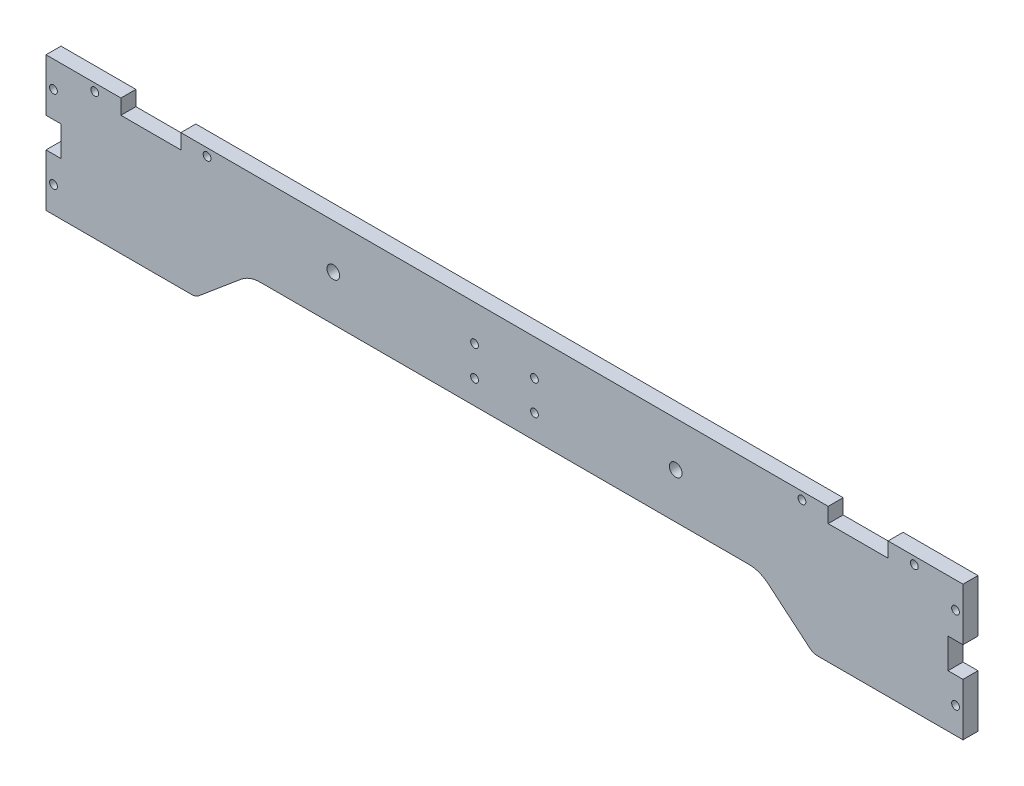
from build123d import *

# Parameters (mm, degrees)
SKETCH1_R           = 1.65
SKETCH1_R_2         = 2.7
BOSS_EXTRUDE1_DEPTH = 6.35


with BuildPart() as part:
    # Sketch1 → Boss-Extrude1 (new body)
    with BuildSketch(Plane.XY.offset(222.25)):
        with BuildLine():
            Line((-25.4, 57.15), (-25.4, 50.8))
            Line((-25.4, 50.8), (-50.8, 50.8))
            Line((-50.8, 50.8), (-50.8, 57.15))
            Line((-50.8, 57.15), (-325.12, 57.15))
            Line((-325.12, 57.15), (-325.12, 50.8))
            Line((-325.12, 50.8), (-350.52, 50.8))
            Line((-350.52, 50.8), (-350.52, 57.15))
            Line((-350.52, 57.15), (-382.27, 57.15))
            Line((-382.27, 57.15), (-382.27, 34.925))
            Line((-382.27, 34.925), (-375.92, 34.925))
            Line((-375.92, 34.925), (-375.92, 22.225))
            Line((-375.92, 22.225), (-382.27, 22.225))
            Line((-382.27, 22.225), (-382.27, 0))
            Line((-382.27, 0), (-320.61896879, 0))
            ThreePointArc((-320.61896879, 0), (-318.881506462, 0.306361486), (-317.353607733, 1.188494229))
            Line((-317.353607733, 1.188494229), (-299.608074729, 16.078764428))
            ThreePointArc((-299.608074729, 16.078764428), (-295.788327906, 18.284096284), (-291.444672086, 19.05))
            Line((-291.444672086, 19.05), (-84.475327914, 19.05))
            ThreePointArc((-84.475327914, 19.05), (-80.131672094, 18.284096284), (-76.311925271, 16.078764428))
            Line((-76.311925271, 16.078764428), (-58.566392267, 1.188494229))
            ThreePointArc((-58.566392267, 1.188494229), (-57.038493538, 0.306361486), (-55.30103121, 0))
            Line((-55.30103121, 0), (6.35, 0))
            Line((6.35, 0), (6.35, 22.225))
            Line((6.35, 22.225), (0, 22.225))
            Line((0, 22.225), (0, 34.925))
            Line((0, 34.925), (6.35, 34.925))
            Line((6.35, 34.925), (6.35, 57.15))
            Line((6.35, 57.15), (-25.4, 57.15))
        make_face()
        with Locations((-379.095, 11.1125)):
            Circle(SKETCH1_R, mode=Mode.SUBTRACT)
        with Locations((3.175, 11.1125)):
            Circle(SKETCH1_R, mode=Mode.SUBTRACT)
        with Locations((-379.095, 46.0375)):
            Circle(SKETCH1_R, mode=Mode.SUBTRACT)
        with Locations((3.175, 46.0375)):
            Circle(SKETCH1_R, mode=Mode.SUBTRACT)
        with Locations((-175.260005593, 41.91)):
            Circle(SKETCH1_R, mode=Mode.SUBTRACT)
        with Locations((-200.66, 41.91)):
            Circle(SKETCH1_R, mode=Mode.SUBTRACT)
        with Locations((-175.260005593, 29.21)):
            Circle(SKETCH1_R, mode=Mode.SUBTRACT)
        with Locations((-200.66, 29.21)):
            Circle(SKETCH1_R, mode=Mode.SUBTRACT)
        with Locations((-14.2875, 53.975)):
            Circle(SKETCH1_R, mode=Mode.SUBTRACT)
        with Locations((-361.6325, 53.975)):
            Circle(SKETCH1_R, mode=Mode.SUBTRACT)
        with Locations((-61.9125, 53.975)):
            Circle(SKETCH1_R, mode=Mode.SUBTRACT)
        with Locations((-314.0075, 53.975)):
            Circle(SKETCH1_R, mode=Mode.SUBTRACT)
        with Locations((-115.41, 38.26)):
            Circle(SKETCH1_R_2, mode=Mode.SUBTRACT)
        with Locations((-260.51, 38.26)):
            Circle(SKETCH1_R_2, mode=Mode.SUBTRACT)
    extrude(amount=-BOSS_EXTRUDE1_DEPTH)


solid = part.part
